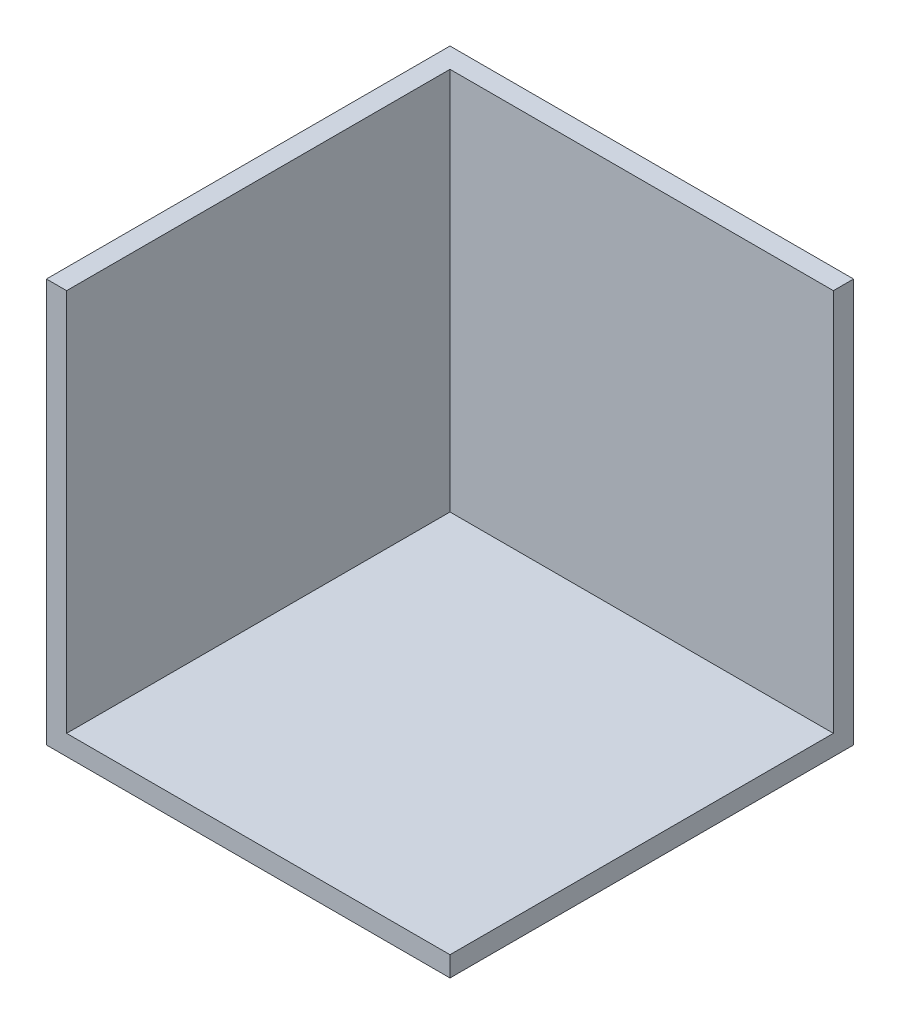
from build123d import *

# Parameters (mm, degrees)
ESQUISSE1_W        = 16
ESQUISSE1_H        = 16
BOSS_EXTRU_1_DEPTH = 16
COQUE1_T           = -0.8


with BuildPart() as part:
    # Esquisse1 → Boss.-Extru.1 (new body)
    with BuildSketch(Plane(origin=(0, 0, 0), x_dir=(1, 0, 0), z_dir=(0, 1, 0))):
        Rectangle(ESQUISSE1_W, ESQUISSE1_H)
    extrude(amount=BOSS_EXTRU_1_DEPTH)

    # Coque1
    coque1_openings = [part.faces().sort_by_distance(p)[0] for p in [
        (0, 8, 8),
        (8, 8, 0),
        (0, 16, 0),
    ]]
    offset(amount=COQUE1_T, openings=coque1_openings, kind=Kind.INTERSECTION)


solid = part.part
